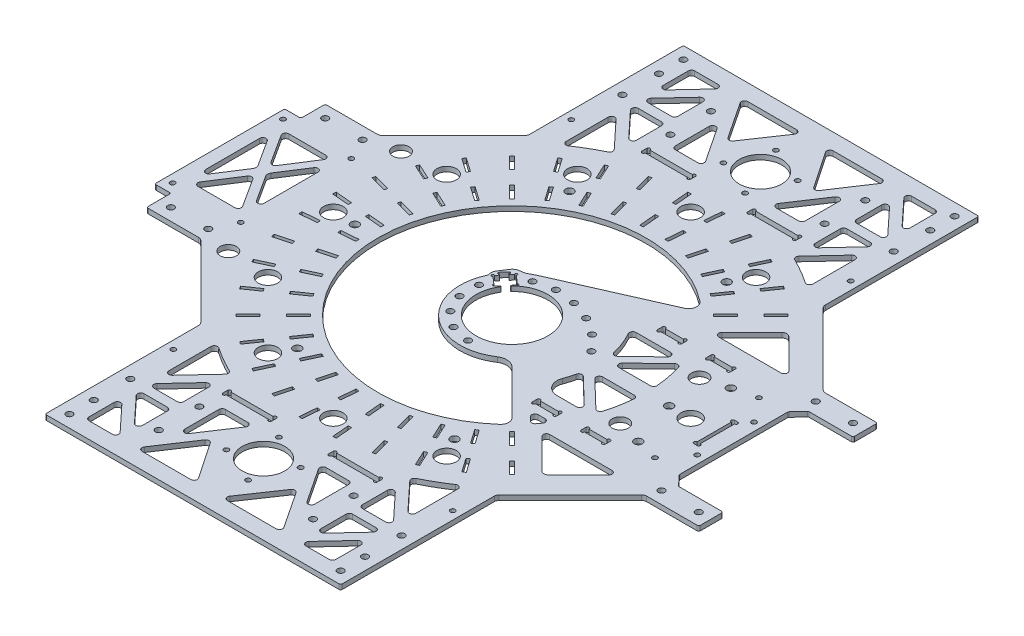
from build123d import *

# Parameters (mm, degrees)
EXTRUDE_2_OUTLINE_R   = 135
EXTRUDE_2_OUTLINE_R_2 = 2
EXTRUDE_2_OUTLINE_R_3 = 22.1
EXTRUDE_2_DEPTH       = 3
SKETCH_7_R            = 2.5
CUT_EXTRUDE_3_DEPTH   = 191.942399692
EXTRUDE_START         = -3
SKETCH_8_R            = 2
SKETCH_8_R_2          = 1.5
EXTRUDE_3_DEPTH       = 3
SKETCH_9_R            = 1.5
SKETCH_9_R_2          = 6
SKETCH_9_R_3          = 2.5
SKETCH_9_R_4          = 5
SKETCH_9_R_5          = 13.1
SKETCH_9_W            = 2
SKETCH_9_H            = 25
CUT_EXTRUDE_4_DEPTH   = 267.498123821
SKETCH_11_W           = 15
SKETCH_11_H           = 3
CUT_EXTRUDE_6_DEPTH   = 267.498123821
EXTRUDE_4_DEPTH       = 3
SKETCH_13_R           = 2
SKETCH_13_R_2         = 1.5
SKETCH_13_W           = 30
SKETCH_13_H           = 3
CUT_EXTRUDE_7_DEPTH   = 267.498123821
SKETCH_14_R           = 1
CUT_EXTRUDE_8_DEPTH   = 267.498123821
SKETCH_25_R           = 5
SKETCH_25_W           = 36
SKETCH_25_H           = 56
CUT_EXTRUDE_14_DEPTH  = 267.498123821
EXTRUDE_1_DEPTH       = 3
CUT_EXTRUDE_15_DEPTH  = 10
SKETCH_30_R           = 0.75
CUT_EXTRUDE_16_DEPTH  = 10
FILLET_1_R            = 3
FILLET_6_R            = 1
FILLET_8_R            = 2


with BuildPart() as part:
    # 凸台-拉伸2: read off the stored shape, not the designer's step
    # 凸台-拉伸2 outline → 凸台-拉伸2 (new body)
    with BuildSketch(Plane(origin=(0, 0, 0), x_dir=(1, 0, 0), z_dir=(0, 1, 0))):
        Circle(EXTRUDE_2_OUTLINE_R)
        with Locations((-11.714860956, -24.326159433)):
            Circle(EXTRUDE_2_OUTLINE_R_2, mode=Mode.SUBTRACT)
        with Locations((-21.109450027, -16.83422465)):
            Circle(EXTRUDE_2_OUTLINE_R_2, mode=Mode.SUBTRACT)
        with Locations((-26.323053629, -6.008065217)):
            Circle(EXTRUDE_2_OUTLINE_R_2, mode=Mode.SUBTRACT)
        with Locations((0, -27)):
            Circle(EXTRUDE_2_OUTLINE_R_2, mode=Mode.SUBTRACT)
        with Locations((-26.323053629, 6.008065217)):
            Circle(EXTRUDE_2_OUTLINE_R_2, mode=Mode.SUBTRACT)
        with Locations((-11.714860956, 24.326159433)):
            Circle(EXTRUDE_2_OUTLINE_R_2, mode=Mode.SUBTRACT)
        Circle(EXTRUDE_2_OUTLINE_R_3, mode=Mode.SUBTRACT)
        with Locations((0, 27)):
            Circle(EXTRUDE_2_OUTLINE_R_2, mode=Mode.SUBTRACT)
        with Locations((12.540402558, 25.523692784)):
            Circle(EXTRUDE_2_OUTLINE_R_2, mode=Mode.SUBTRACT)
        with Locations((24.405378925, 21.203563722)):
            Circle(EXTRUDE_2_OUTLINE_R_2, mode=Mode.SUBTRACT)
        with Locations((43.69592095, 5.163960916)):
            Circle(EXTRUDE_2_OUTLINE_R_2, mode=Mode.SUBTRACT)
        with Locations((34.97553353, 14.296103193)):
            Circle(EXTRUDE_2_OUTLINE_R_2, mode=Mode.SUBTRACT)
    extrude(amount=EXTRUDE_2_DEPTH)

    # 草图7 → 切除-拉伸3 (cut, through all)
    with BuildSketch(Plane(origin=(0, 3, 0), x_dir=(1, 0, 0), z_dir=(0, 1, 0))):
        with Locations(Location((96.75, 0, 0), (0, 0, 270))):
            Circle(SKETCH_7_R)
        with Locations(Location((48.375, -83.787957816, 0), (0, 0, 270))):
            Circle(SKETCH_7_R)
        with Locations(Location((-48.375, -83.787957816, 0), (0, 0, 270))):
            Circle(SKETCH_7_R)
        with Locations(Location((-96.75, 0, 0), (0, 0, 270))):
            Circle(SKETCH_7_R)
        with Locations(Location((-48.375, 83.787957816, 0), (0, 0, 270))):
            Circle(SKETCH_7_R)
        with Locations(Location((48.375, 83.787957816, 0), (0, 0, 270))):
            Circle(SKETCH_7_R)
        with BuildLine():
            Line((-23.944417996, 22.009220284), (-26.66858516, 18.812516785))
            Line((-26.66858516, 18.812516785), (-18.599424602, 11.936138592))
            ThreePointArc((-18.599424602, 11.936138592), (-17.380019908, 13.650820781), (-16.003077925, 15.241768169))
            Line((-16.003077925, 15.241768169), (-23.944417996, 22.009220284))
        make_face()
    extrude(amount=-CUT_EXTRUDE_3_DEPTH, mode=Mode.SUBTRACT)

    # 草图8 → 凸台-拉伸3 (add)
    # profile 1 of 4: a face of its own
    with BuildSketch(Plane(origin=(0, 3, 0), x_dir=(1, 0, 0), z_dir=(0, 1, 0)).offset(EXTRUDE_START)):
        with BuildLine():
            Line((123.288280059, 55), (170, 55))
            Line((170, 55), (170, 40))
            Line((170, 40), (142.5, 40))
            Line((142.5, 40), (136.5, 33.5))
            Line((136.5, 33.5), (136.5, -33.5))
            Line((136.5, -33.5), (142.5, -40))
            Line((142.5, -40), (170, -40))
            Line((170, -40), (170, -55))
            Line((170, -55), (123.288280059, -55))
            ThreePointArc((123.288280059, -55), (135, 0), (123.288280059, 55))
        make_face()
        with Locations(Location((162.5, 47.5, 0), (0, 0, 270))):
            Circle(SKETCH_8_R, mode=Mode.SUBTRACT)
        with Locations(Location((139.5, 47.5, 0), (0, 0, 270))):
            Circle(SKETCH_8_R, mode=Mode.SUBTRACT)
        with Locations(Location((139.5, -47.5, 0), (0, 0, 270))):
            Circle(SKETCH_8_R, mode=Mode.SUBTRACT)
        with Locations(Location((162.5, -47.5, 0), (0, 0, 270))):
            Circle(SKETCH_8_R, mode=Mode.SUBTRACT)
    # profile 2 of 4: a face of its own
    with BuildSketch(Plane(origin=(0, 3, 0), x_dir=(1, 0, 0), z_dir=(0, 1, 0)).offset(EXTRUDE_START)):
        with BuildLine():
            Line((-91, 99.719606899), (-91, 196.5))
            Line((-91, 196.5), (91, 196.5))
            Line((91, 196.5), (91, 99.719606899))
            ThreePointArc((91, 99.719606899), (0, 135), (-91, 99.719606899))
        make_face()
    # profile 3 of 4: a face of its own
    with BuildSketch(Plane(origin=(0, 3, 0), x_dir=(1, 0, 0), z_dir=(0, 1, 0)).offset(EXTRUDE_START)):
        with BuildLine():
            Line((91, -196.5), (91, -99.719606899))
            ThreePointArc((91, -99.719606899), (0, -135), (-91, -99.719606899))
            Line((-91, -99.719606899), (-91, -196.5))
            Line((-91, -196.5), (91, -196.5))
        make_face()
    # profile 4 of 4: a face of its own
    with BuildSketch(Plane(origin=(0, 3, 0), x_dir=(1, 0, 0), z_dir=(0, 1, 0)).offset(EXTRUDE_START)):
        with BuildLine():
            Line((-123.288280059, -55), (-170, -55))
            Line((-170, -55), (-170, -40))
            Line((-170, -40), (-180, -40))
            Line((-180, -40), (-180, 40))
            Line((-180, 40), (-170, 40))
            Line((-170, 40), (-170, 55))
            Line((-170, 55), (-123.288280059, 55))
            ThreePointArc((-123.288280059, 55), (-135, 0), (-123.288280059, -55))
        make_face()
        with Locations(Location((-162.5, -47.5, 0), (0, 0, 270))):
            Circle(SKETCH_8_R, mode=Mode.SUBTRACT)
        with Locations(Location((-139.5, -47.5, 0), (0, 0, 270))):
            Circle(SKETCH_8_R, mode=Mode.SUBTRACT)
        with Locations(Location((-139.5, 47.5, 0), (0, 0, 270))):
            Circle(SKETCH_8_R, mode=Mode.SUBTRACT)
        with Locations(Location((-162.5, 47.5, 0), (0, 0, 270))):
            Circle(SKETCH_8_R, mode=Mode.SUBTRACT)
        with Locations(Location((-175, 34, 0), (0, 0, 270))):
            Circle(SKETCH_8_R_2, mode=Mode.SUBTRACT)
        with Locations(Location((-175, -34, 0), (0, 0, 270))):
            Circle(SKETCH_8_R_2, mode=Mode.SUBTRACT)
        with Locations(Location((-133, -34, 0), (0, 0, 270))):
            Circle(SKETCH_8_R_2, mode=Mode.SUBTRACT)
        with Locations(Location((-133, 34, 0), (0, 0, 270))):
            Circle(SKETCH_8_R_2, mode=Mode.SUBTRACT)
    extrude(amount=EXTRUDE_3_DEPTH)

    # 草图9 → 切除-拉伸4 (cut, through all)
    with BuildSketch(Plane(origin=(0, 3, 0), x_dir=(1, 0, 0), z_dir=(0, 1, 0))):
        with Locations(Location((-6.696960066, 169.167891819, 0), (0, 0, 270))):
            Circle(SKETCH_9_R)
        with Locations(Location((0, 110, 0), (0, 0, 270))):
            Circle(SKETCH_9_R_2)
        with Locations(Location((106.251840892, 28.470094961, 0), (0, 0, 270))):
            Circle(SKETCH_9_R_3)
        with Locations(Location((55, 95.262794416, 0), (0, 0, 270))):
            Circle(SKETCH_9_R_2)
        with Locations(Location((91.038509128, 24.393695001, 0), (0, 0, 270))):
            Circle(SKETCH_9_R_4)
        with Locations(Location((91.038509128, -24.393695001, 0), (0, 0, 270))):
            Circle(SKETCH_9_R_4)
        with Locations(Location((106.251840892, -28.470094961, 0), (0, 0, 270))):
            Circle(SKETCH_9_R_3)
        with Locations(Location((110, 0, 0), (0, 0, 270))):
            Circle(SKETCH_9_R_2)
        with Locations(Location((55, -95.262794416, 0), (0, 0, 270))):
            Circle(SKETCH_9_R_2)
        with Locations(Location((0, -110, 0), (0, 0, 270))):
            Circle(SKETCH_9_R_2)
        with Locations(Location((-55, -95.262794416, 0), (0, 0, 270))):
            Circle(SKETCH_9_R_2)
        with Locations(Location((-95.262794416, -55, 0), (0, 0, 270))):
            Circle(SKETCH_9_R_2)
        with Locations(Location((-110, 0, 0), (0, 0, 270))):
            Circle(SKETCH_9_R_2)
        with Locations(Location((-95.262794416, 55, 0), (0, 0, 270))):
            Circle(SKETCH_9_R_2)
        with Locations(Location((-55, 95.262794416, 0), (0, 0, 270))):
            Circle(SKETCH_9_R_2)
        with Locations(Location((120, 32, 0), (0, 0, 270))):
            Circle(SKETCH_9_R)
        with Locations(Location((120, -32, 0), (0, 0, 270))):
            Circle(SKETCH_9_R)
        with Locations(Location((0, 153, 0), (0, 0, 270))):
            Circle(SKETCH_9_R_5)
        with Locations(Location((16.167891819, 159.696960066, 0), (0, 0, 270))):
            Circle(SKETCH_9_R)
        with Locations(Location((6.696960066, 136.832108181, 0), (0, 0, 270))):
            Circle(SKETCH_9_R)
        with Locations(Location((-16.167891819, 146.303039934, 0), (0, 0, 270))):
            Circle(SKETCH_9_R)
        with Locations(Location((-6.696960066, -136.832108181, 0), (0, 0, 270))):
            Circle(SKETCH_9_R)
        with Locations(Location((0, -153, 0), (0, 0, 270))):
            Circle(SKETCH_9_R_5)
        with Locations(Location((16.167891819, -146.303039934, 0), (0, 0, 270))):
            Circle(SKETCH_9_R)
        with Locations(Location((6.696960066, -169.167891819, 0), (0, 0, 270))):
            Circle(SKETCH_9_R)
        with Locations(Location((-16.167891819, -159.696960066, 0), (0, 0, 270))):
            Circle(SKETCH_9_R)
        with Locations(Location((131.5, 17.5, 0), (0, 0, 270))):
            Circle(SKETCH_9_R)
        with Locations(Location((131.5, -17.5, 0), (0, 0, 90))):
            Circle(SKETCH_9_R)
        with BuildLine():
            Line((-12.931672736, 29.270665183), (49.357543828, 56.789813059))
            ThreePointArc((49.357543828, 56.789813059), (52.300695439, 60.76216451), (50.390968025, 65.32228059))
            ThreePointArc((50.390968025, 65.32228059), (-82.458070407, -2.629947673), (54.45114247, -61.978408205))
            ThreePointArc((54.45114247, -61.978408205), (56.148468382, -58.383515435), (54.686607136, -54.686607136))
            Line((54.686607136, -54.686607136), (27.712812921, -27.712812921))
            ThreePointArc((27.712812921, -27.712812921), (22.860030368, -25.410177947), (17.644766937, -26.695733736))
            ThreePointArc((17.644766937, -26.695733736), (-21.048434027, -24.103182881), (-28.829108868, 13.888213775))
            ThreePointArc((-28.829108868, 13.888213775), (-28.782435247, 14.075330073), (-28.814021115, 14.265575358))
            ThreePointArc((-28.814021115, 14.265575358), (-29.122939909, 16.594282895), (-28.334302935, 18.807055213))
            Line((-28.334302935, 18.807055213), (-25.048700438, 23.827495058))
            ThreePointArc((-25.048700438, 23.827495058), (-23.336585416, 25.435901649), (-21.078911577, 26.08491509))
            ThreePointArc((-21.078911577, 26.08491509), (-18.645378551, 26.493867679), (-16.386082739, 27.486292811))
            ThreePointArc((-16.386082739, 27.486292811), (-14.686003293, 28.430992021), (-12.931672736, 29.270665183))
        make_face()
        with Locations((125.5, 0)):
            Rectangle(SKETCH_9_W, SKETCH_9_H)
    extrude(amount=-CUT_EXTRUDE_4_DEPTH, mode=Mode.SUBTRACT)

    # 草图11 → 切除-拉伸6 (cut, through all)
    with BuildSketch(Plane(origin=(0, 3, 0), x_dir=(1, 0, 0), z_dir=(0, 1, 0))):
        Polygon((62.791082169, -61.376868607), (70.144992694, -68.730779131), (68.730779131, -70.144992694), (61.376868607, -62.791082169), align=None)
        Polygon((78.347431355, -76.933217793), (85.70134188, -84.287128317), (84.287128317, -85.70134188), (76.933217793, -78.347431355), align=None)
        Polygon((51.179163156, -71.347973052), (57.144358094, -79.867154313), (55.506054005, -81.014307186), (49.540859067, -72.495125925), align=None)
        Polygon((63.797844756, -89.369318027), (69.763039694, -97.888499287), (68.124735605, -99.03565216), (62.159540667, -90.516470899), align=None)
        Polygon((38.012191168, -79.15120544), (42.40742109, -88.576806425), (40.594805516, -89.422042949), (36.199575594, -79.996441964), align=None)
        Polygon((47.309792926, -99.089976755), (51.705022848, -108.51557774), (49.892407274, -109.360814264), (45.497177352, -99.935213278), align=None)
        Polygon((23.690237986, -84.549468503), (26.381956055, -94.595097096), (24.450104403, -95.112735187), (21.758386334, -85.067106593), align=None)
        Polygon((29.384256979, -105.799836681), (32.075975048, -115.845465275), (30.144123395, -116.363103365), (27.452405326, -106.317474772), align=None)
        Polygon((8.648468911, -87.37873875), (9.554888636, -97.73916361), (7.56249924, -97.913475095), (6.656079515, -87.553050235), align=None)
        Polygon((10.565895252, -109.295022108), (11.472314976, -119.655446968), (9.47992558, -119.829758453), (8.573505856, -109.469333593), align=None)
        Polygon((-6.656079515, -87.553050235), (-7.56249924, -97.913475095), (-9.554888636, -97.73916361), (-8.648468911, -87.37873875), align=None)
        Polygon((-8.573505856, -109.469333593), (-9.47992558, -119.829758453), (-11.472314976, -119.655446968), (-10.565895252, -109.295022108), align=None)
        Polygon((-21.758386334, -85.067106593), (-24.450104403, -95.112735187), (-26.381956055, -94.595097096), (-23.690237986, -84.549468503), align=None)
        Polygon((-27.452405326, -106.317474772), (-30.144123395, -116.363103365), (-32.075975048, -115.845465275), (-29.384256979, -105.799836681), align=None)
        Polygon((-36.199575594, -79.996441964), (-40.594805516, -89.422042949), (-42.40742109, -88.576806425), (-38.012191168, -79.15120544), align=None)
        Polygon((-45.497177352, -99.935213278), (-49.892407274, -109.360814264), (-51.705022848, -108.51557774), (-47.309792926, -99.089976755), align=None)
        Polygon((-49.540859067, -72.495125925), (-55.506054005, -81.014307186), (-57.144358094, -79.867154313), (-51.179163156, -71.347973052), align=None)
        Polygon((-62.159540667, -90.516470899), (-68.124735605, -99.03565216), (-69.763039694, -97.888499287), (-63.797844756, -89.369318027), align=None)
        Polygon((-61.376868607, -62.791082169), (-68.730779131, -70.144992694), (-70.144992694, -68.730779131), (-62.791082169, -61.376868607), align=None)
        Polygon((-76.933217793, -78.347431355), (-84.287128317, -85.70134188), (-85.70134188, -84.287128317), (-78.347431355, -76.933217793), align=None)
        Polygon((-71.347973052, -51.179163156), (-79.867154313, -57.144358094), (-81.014307186, -55.506054005), (-72.495125925, -49.540859067), align=None)
        Polygon((-89.369318027, -63.797844756), (-97.888499287, -69.763039694), (-99.03565216, -68.124735605), (-90.516470899, -62.159540667), align=None)
        Polygon((-79.15120544, -38.012191168), (-88.576806425, -42.40742109), (-89.422042949, -40.594805516), (-79.996441964, -36.199575594), align=None)
        Polygon((-99.089976755, -47.309792926), (-108.51557774, -51.705022848), (-109.360814264, -49.892407274), (-99.935213278, -45.497177352), align=None)
        Polygon((-84.549468503, -23.690237986), (-94.595097096, -26.381956055), (-95.112735187, -24.450104403), (-85.067106593, -21.758386334), align=None)
        Polygon((-105.799836681, -29.384256979), (-115.845465275, -32.075975048), (-116.363103365, -30.144123395), (-106.317474772, -27.452405326), align=None)
        Polygon((-87.37873875, -8.648468911), (-97.73916361, -9.554888636), (-97.913475095, -7.56249924), (-87.553050235, -6.656079515), align=None)
        Polygon((-109.295022108, -10.565895252), (-119.655446968, -11.472314976), (-119.829758453, -9.47992558), (-109.469333593, -8.573505856), align=None)
        Polygon((-87.553050235, 6.656079515), (-97.913475095, 7.56249924), (-97.73916361, 9.554888636), (-87.37873875, 8.648468911), align=None)
        Polygon((-109.469333593, 8.573505856), (-119.829758453, 9.47992558), (-119.655446968, 11.472314976), (-109.295022108, 10.565895252), align=None)
        Polygon((-85.067106593, 21.758386334), (-95.112735187, 24.450104403), (-94.595097096, 26.381956055), (-84.549468503, 23.690237986), align=None)
        Polygon((-106.317474772, 27.452405326), (-116.363103365, 30.144123395), (-115.845465275, 32.075975048), (-105.799836681, 29.384256979), align=None)
        Polygon((-79.996441964, 36.199575594), (-89.422042949, 40.594805516), (-88.576806425, 42.40742109), (-79.15120544, 38.012191168), align=None)
        Polygon((-99.935213278, 45.497177352), (-109.360814264, 49.892407274), (-108.51557774, 51.705022848), (-99.089976755, 47.309792926), align=None)
        Polygon((-72.495125925, 49.540859067), (-81.014307186, 55.506054005), (-79.867154313, 57.144358094), (-71.347973052, 51.179163156), align=None)
        Polygon((-90.516470899, 62.159540667), (-99.03565216, 68.124735605), (-97.888499287, 69.763039694), (-89.369318027, 63.797844756), align=None)
        Polygon((-62.791082169, 61.376868607), (-70.144992694, 68.730779131), (-68.730779131, 70.144992694), (-61.376868607, 62.791082169), align=None)
        Polygon((-78.347431355, 76.933217793), (-85.70134188, 84.287128317), (-84.287128317, 85.70134188), (-76.933217793, 78.347431355), align=None)
        Polygon((-51.179163156, 71.347973052), (-57.144358094, 79.867154313), (-55.506054005, 81.014307186), (-49.540859067, 72.495125925), align=None)
        Polygon((-63.797844756, 89.369318027), (-69.763039694, 97.888499287), (-68.124735605, 99.03565216), (-62.159540667, 90.516470899), align=None)
        Polygon((-38.012191168, 79.15120544), (-42.40742109, 88.576806425), (-40.594805516, 89.422042949), (-36.199575594, 79.996441964), align=None)
        Polygon((-47.309792926, 99.089976755), (-51.705022848, 108.51557774), (-49.892407274, 109.360814264), (-45.497177352, 99.935213278), align=None)
        Polygon((-23.690237986, 84.549468503), (-26.381956055, 94.595097096), (-24.450104403, 95.112735187), (-21.758386334, 85.067106593), align=None)
        Polygon((-29.384256979, 105.799836681), (-32.075975048, 115.845465275), (-30.144123395, 116.363103365), (-27.452405326, 106.317474772), align=None)
        Polygon((-8.648468911, 87.37873875), (-9.554888636, 97.73916361), (-7.56249924, 97.913475095), (-6.656079515, 87.553050235), align=None)
        Polygon((-10.565895252, 109.295022108), (-11.472314976, 119.655446968), (-9.47992558, 119.829758453), (-8.573505856, 109.469333593), align=None)
        Polygon((6.656079515, 87.553050235), (7.56249924, 97.913475095), (9.554888636, 97.73916361), (8.648468911, 87.37873875), align=None)
        Polygon((8.573505856, 109.469333593), (9.47992558, 119.829758453), (11.472314976, 119.655446968), (10.565895252, 109.295022108), align=None)
        Polygon((21.758386334, 85.067106593), (24.450104403, 95.112735187), (26.381956055, 94.595097096), (23.690237986, 84.549468503), align=None)
        Polygon((27.452405326, 106.317474772), (30.144123395, 116.363103365), (32.075975048, 115.845465275), (29.384256979, 105.799836681), align=None)
        Polygon((36.199575594, 79.996441964), (40.594805516, 89.422042949), (42.40742109, 88.576806425), (38.012191168, 79.15120544), align=None)
        Polygon((45.497177352, 99.935213278), (49.892407274, 109.360814264), (51.705022848, 108.51557774), (47.309792926, 99.089976755), align=None)
        Polygon((49.540859067, 72.495125925), (55.506054005, 81.014307186), (57.144358094, 79.867154313), (51.179163156, 71.347973052), align=None)
        Polygon((62.159540667, 90.516470899), (68.124735605, 99.03565216), (69.763039694, 97.888499287), (63.797844756, 89.369318027), align=None)
        Polygon((61.376868607, 62.791082169), (68.730779131, 70.144992694), (70.144992694, 68.730779131), (62.791082169, 61.376868607), align=None)
        Polygon((76.933217793, 78.347431355), (84.287128317, 85.70134188), (85.70134188, 84.287128317), (78.347431355, 76.933217793), align=None)
        with Locations((60, 38.5)):
            Rectangle(SKETCH_11_W, SKETCH_11_H)
        with Locations((60, -38.5)):
            Rectangle(SKETCH_11_W, SKETCH_11_H)
        with Locations((90, 38.5)):
            Rectangle(SKETCH_11_W, SKETCH_11_H)
        with Locations((90, -38.5)):
            Rectangle(SKETCH_11_W, SKETCH_11_H)
    extrude(amount=-CUT_EXTRUDE_6_DEPTH, mode=Mode.SUBTRACT)

    # 草图12 → 凸台-拉伸4 (add)
    with BuildSketch(Plane(origin=(0, 3, 0), x_dir=(1, 0, 0), z_dir=(0, 1, 0)).offset(EXTRUDE_START)):
        with BuildLine():
            Line((91, 100.625937702), (136.625937702, 55))
            Line((136.625937702, 55), (123.288280059, 55))
            ThreePointArc((123.288280059, 55), (109.452398571, 79.02640348), (91, 99.719606899))
            Line((91, 99.719606899), (91, 100.625937702))
        make_face()
        with BuildLine():
            Line((91, -100.625937702), (136.625937702, -55))
            Line((136.625937702, -55), (123.288280059, -55))
            ThreePointArc((123.288280059, -55), (109.452398571, -79.02640348), (91, -99.719606899))
            Line((91, -99.719606899), (91, -100.625937702))
        make_face()
        with BuildLine():
            Line((-91, -100.625937702), (-91, -99.719606899))
            ThreePointArc((-91, -99.719606899), (-109.452398571, -79.02640348), (-123.288280059, -55))
            Line((-123.288280059, -55), (-136.625937702, -55))
            Line((-136.625937702, -55), (-91, -100.625937702))
        make_face()
        with BuildLine():
            Line((-136.625937702, 55), (-123.288280059, 55))
            ThreePointArc((-123.288280059, 55), (-109.452398571, 79.02640348), (-91, 99.719606899))
            Line((-91, 99.719606899), (-91, 100.625937702))
            Line((-91, 100.625937702), (-136.625937702, 55))
        make_face()
    extrude(amount=EXTRUDE_4_DEPTH)

    # 草图13 → 切除-拉伸7 (cut, through all)
    with BuildSketch(Plane(origin=(0, 3, 0), x_dir=(1, 0, 0), z_dir=(0, 1, 0))):
        with Locations(Location((83.5, -151.5, 0), (0, 0, 90))):
            Circle(SKETCH_13_R)
        with Locations(Location((47.5, 145, 0), (0, 0, 270))):
            Circle(SKETCH_13_R)
        with Locations(Location((-47.5, 145, 0), (0, 0, 270))):
            Circle(SKETCH_13_R)
        with Locations(Location((-47.5, 170, 0), (0, 0, 270))):
            Circle(SKETCH_13_R)
        with Locations(Location((47.5, 170, 0), (0, 0, 270))):
            Circle(SKETCH_13_R)
        with Locations(Location((-47.5, -170, 0), (0, 0, 90))):
            Circle(SKETCH_13_R)
        with Locations(Location((-47.5, -145, 0), (0, 0, 90))):
            Circle(SKETCH_13_R)
        with Locations(Location((47.5, -170, 0), (0, 0, 90))):
            Circle(SKETCH_13_R)
        with Locations(Location((47.5, -145, 0), (0, 0, 90))):
            Circle(SKETCH_13_R)
        with Locations(Location((83.5, -174, 0), (0, 0, 90))):
            Circle(SKETCH_13_R)
        with Locations(Location((83.5, 189, 0), (0, 0, 270))):
            Circle(SKETCH_13_R)
        with Locations(Location((83.5, 174, 0), (0, 0, 270))):
            Circle(SKETCH_13_R)
        with Locations(Location((83.5, 151.5, 0), (0, 0, 270))):
            Circle(SKETCH_13_R)
        with Locations(Location((83.5, -189, 0), (0, 0, 90))):
            Circle(SKETCH_13_R)
        with Locations(Location((-83.5, 151.5, 0), (0, 0, 90))):
            Circle(SKETCH_13_R)
        with Locations(Location((-83.5, 174, 0), (0, 0, 90))):
            Circle(SKETCH_13_R)
        with Locations(Location((-83.5, 189, 0), (0, 0, 90))):
            Circle(SKETCH_13_R)
        with Locations(Location((-83.5, -174, 0), (0, 0, 270))):
            Circle(SKETCH_13_R)
        with Locations(Location((-83.5, -151.5, 0), (0, 0, 270))):
            Circle(SKETCH_13_R)
        with Locations(Location((-83.5, -189, 0), (0, 0, 270))):
            Circle(SKETCH_13_R)
        with Locations(Location((85.999999851, 122.500000104, 0), (0, 0, 270))):
            Circle(SKETCH_13_R_2)
        with Locations(Location((-85.999999851, 122.500000104, 0), (0, 0, 90))):
            Circle(SKETCH_13_R_2)
        with Locations(Location((-85.999999851, -122.500000104, 0), (0, 0, 270))):
            Circle(SKETCH_13_R_2)
        with Locations(Location((85.999999851, -122.500000104, 0), (0, 0, 90))):
            Circle(SKETCH_13_R_2)
        with Locations((-32.5, 129)):
            Rectangle(SKETCH_13_W, SKETCH_13_H)
        with Locations((32.5, 129)):
            Rectangle(SKETCH_13_W, SKETCH_13_H)
        with Locations((32.5, -129)):
            Rectangle(SKETCH_13_W, SKETCH_13_H)
        with Locations((-32.5, -129)):
            Rectangle(SKETCH_13_W, SKETCH_13_H)
    extrude(amount=-CUT_EXTRUDE_7_DEPTH, mode=Mode.SUBTRACT)

    # 草图14 → 切除-拉伸8 (cut, through all)
    with BuildSketch(Plane(origin=(0, 3, 0), x_dir=(1, 0, 0), z_dir=(0, 1, 0))):
        with Locations((-46.5, 130.5)):
            Circle(SKETCH_14_R)
        with Locations((-46.5, 127.5)):
            Circle(SKETCH_14_R)
        with Locations((-18.5, 127.5)):
            Circle(SKETCH_14_R)
        with Locations((18.5, 130.5)):
            Circle(SKETCH_14_R)
        with Locations((18.5, 127.5)):
            Circle(SKETCH_14_R)
        with Locations((46.5, 130.5)):
            Circle(SKETCH_14_R)
        with Locations((46.5, 127.5)):
            Circle(SKETCH_14_R)
        with Locations((46.5, -127.5)):
            Circle(SKETCH_14_R)
        with Locations((46.5, -130.5)):
            Circle(SKETCH_14_R)
        with Locations((18.5, -127.5)):
            Circle(SKETCH_14_R)
        with Locations((18.5, -130.5)):
            Circle(SKETCH_14_R)
        with Locations((-18.5, -127.5)):
            Circle(SKETCH_14_R)
        with Locations((-46.5, -127.5)):
            Circle(SKETCH_14_R)
        with Locations((-46.5, -130.5)):
            Circle(SKETCH_14_R)
        with Locations((-18.5, 130.5)):
            Circle(SKETCH_14_R)
        with Locations((-18.5, -130.5)):
            Circle(SKETCH_14_R)
        with Locations((53.5, 40)):
            Circle(SKETCH_14_R)
        with Locations((53.5, 37)):
            Circle(SKETCH_14_R)
        with Locations((66.5, 40)):
            Circle(SKETCH_14_R)
        with Locations((66.5, 37)):
            Circle(SKETCH_14_R)
        with Locations((83.5, 40)):
            Circle(SKETCH_14_R)
        with Locations((83.5, 37)):
            Circle(SKETCH_14_R)
        with Locations((96.5, 40)):
            Circle(SKETCH_14_R)
        with Locations((96.5, 37)):
            Circle(SKETCH_14_R)
        with Locations((96.5, -37)):
            Circle(SKETCH_14_R)
        with Locations((96.5, -40)):
            Circle(SKETCH_14_R)
        with Locations((83.5, -37)):
            Circle(SKETCH_14_R)
        with Locations((83.5, -40)):
            Circle(SKETCH_14_R)
        with Locations((66.5, -37)):
            Circle(SKETCH_14_R)
        with Locations((66.5, -40)):
            Circle(SKETCH_14_R)
        with Locations((53.5, -37)):
            Circle(SKETCH_14_R)
        with Locations((53.5, -40)):
            Circle(SKETCH_14_R)
        with BuildLine():
            Line((126.5, -12.5), (126.5, -10.5))
            ThreePointArc((126.5, -10.5), (127.5, -11.5), (126.5, -12.5))
        make_face()
        with BuildLine():
            Line((124.5, 12.5), (124.5, 10.5))
            ThreePointArc((124.5, 10.5), (123.5, 11.5), (124.5, 12.5))
        make_face()
        with BuildLine():
            Line((126.5, 10.5), (126.5, 12.5))
            ThreePointArc((126.5, 12.5), (127.5, 11.5), (126.5, 10.5))
        make_face()
        with BuildLine():
            Line((124.5, -10.5), (124.5, -12.5))
            ThreePointArc((124.5, -12.5), (123.5, -11.5), (124.5, -10.5))
        make_face()
    extrude(amount=-CUT_EXTRUDE_8_DEPTH, mode=Mode.SUBTRACT)

    # 草图25 → 切除-拉伸14 (cut, through all)
    with BuildSketch(Plane(origin=(0, 3, 0), x_dir=(1, 0, 0), z_dir=(0, 1, 0))):
        with Locations(Location((-121.5, 53.155374953, 0), (0, 0, 270))):
            Circle(SKETCH_25_R)
        with Locations(Location((-121.5, -53.155374953, 0), (0, 0, 90))):
            Circle(SKETCH_25_R)
        Polygon((70.384776311, -52), (94.398755288, -76.013978978), (118.412734266, -52), align=None)
        with BuildLine():
            Line((76, 140.342111734), (76, 105.470374987))
            ThreePointArc((76, 105.470374987), (65.789108374, 112.12400822), (55, 117.792189894))
            Line((55, 117.792189894), (76, 140.342111734))
        make_face()
        with Locations((-154, 0)):
            Rectangle(SKETCH_25_W, SKETCH_25_H)
        with BuildLine():
            Line((43.763569324, 29), (77.235030912, 29))
            ThreePointArc((77.235030912, 29), (80.688992456, 17.191174957), (82.34834546, 5))
            Line((82.34834546, 5), (52.261362401, 5))
            ThreePointArc((52.261362401, 5), (49.489361263, 17.522931313), (43.763569324, 29))
        make_face()
        Polygon((40, 168.096752718), (20.382120685, 138.5), (40, 138.5), align=None)
        with BuildLine():
            Line((52.261362401, -5), (82.34834546, -5))
            ThreePointArc((82.34834546, -5), (80.688992456, -17.191174957), (77.235030912, -29))
            Line((77.235030912, -29), (56.738434945, -29))
            ThreePointArc((56.738434945, -29), (50.172809459, -25.570838215), (49.235831977, -18.223140496))
            ThreePointArc((49.235831977, -18.223140496), (51.177465527, -11.709697785), (52.261362401, -5))
        make_face()
        with BuildLine():
            Line((56.313708499, -45), (63.718244174, -52.404535675))
            ThreePointArc((63.718244174, -52.404535675), (66.535497223, -48.777839326), (69.14658343, -45))
            Line((69.14658343, -45), (56.313708499, -45))
        make_face()
        Polygon((118.412734266, 52), (70.384776311, 52), (94.398755288, 76.013978978), align=None)
        Polygon((7.5, 186.5), (45, 186.5), (26.455863104, 158.523161869), align=None)
        Polygon((55, 177.696016787), (55, 155.146094947), (76, 155.146094947), align=None)
        Polygon((55, 149.146094947), (55, 126.596173107), (76, 149.146094947), align=None)
        Polygon((76, 163.95007816), (76, 186.5), (55, 186.5), align=None)
        with BuildLine():
            Line((-55, 117.792189894), (-76, 140.342111734))
            Line((-76, 140.342111734), (-76, 105.470374987))
            ThreePointArc((-76, 105.470374987), (-65.789108374, 112.12400822), (-55, 117.792189894))
        make_face()
        Polygon((-55, 186.5), (-76, 163.95007816), (-76, 186.5), align=None)
        Polygon((-76, 149.146094947), (-55, 149.146094947), (-55, 126.596173107), align=None)
        Polygon((-76, 155.146094947), (-55, 177.696016787), (-55, 155.146094947), align=None)
        Polygon((-26.455863104, 158.523161869), (-7.5, 186.5), (-45, 186.5), align=None)
        Polygon((-40, 138.5), (-40, 168.096752718), (-20.382120685, 138.5), align=None)
        with BuildLine():
            Line((-76, -140.342111734), (-76, -105.470374987))
            ThreePointArc((-76, -105.470374987), (-65.789108374, -112.12400822), (-55, -117.792189894))
            Line((-55, -117.792189894), (-76, -140.342111734))
        make_face()
        Polygon((-40, -168.096752718), (-20.382120685, -138.5), (-40, -138.5), align=None)
        Polygon((-7.5, -186.5), (-45, -186.5), (-26.455863104, -158.523161869), align=None)
        Polygon((-55, -177.696016787), (-55, -155.146094947), (-76, -155.146094947), align=None)
        Polygon((-55, -149.146094947), (-55, -126.596173107), (-76, -149.146094947), align=None)
        Polygon((-76, -163.95007816), (-76, -186.5), (-55, -186.5), align=None)
        with BuildLine():
            Line((55, -117.792189894), (76, -140.342111734))
            Line((76, -140.342111734), (76, -105.470374987))
            ThreePointArc((76, -105.470374987), (65.789108374, -112.12400822), (55, -117.792189894))
        make_face()
        Polygon((55, -186.5), (76, -163.95007816), (76, -186.5), align=None)
        Polygon((76, -149.146094947), (55, -149.146094947), (55, -126.596173107), align=None)
        Polygon((76, -155.146094947), (55, -177.696016787), (55, -155.146094947), align=None)
        Polygon((26.455863104, -158.523161869), (7.5, -186.5), (45, -186.5), align=None)
        Polygon((40, -138.5), (40, -168.096752718), (20.382120685, -138.5), align=None)
    extrude(amount=-CUT_EXTRUDE_14_DEPTH, mode=Mode.SUBTRACT)

    # 草图26 → Extrude 1 (add)
    with BuildSketch(Plane(origin=(0, 3, 0), x_dir=(1, 0, 0), z_dir=(0, 1, 0))):
        Polygon((-133.897053812, -26.648106022), (-169.897053812, 29.351893978), (-174.102946188, 26.648106022), (-138.102946188, -29.351893978), align=None)
        Polygon((-169.897053812, -29.351893978), (-133.897053812, 26.648106022), (-138.102946188, 29.351893978), (-174.102946188, -26.648106022), align=None)
        Polygon((75.502752092, 30.802556543), (50.529083581, 6.802556543), (53.993641221, 3.197443457), (78.967309732, 27.197443457), align=None)
        Polygon((50.529083581, -6.802556543), (75.502752092, -30.802556543), (78.967309732, -27.197443457), (53.993641221, -3.197443457), align=None)
    extrude(amount=-EXTRUDE_1_DEPTH)

    # 草图28 → 切除-拉伸15 (cut)
    with BuildSketch(Plane(origin=(0, 3, 0), x_dir=(1, 0, 0), z_dir=(0, 1, 0))):
        Polygon((-22.422178234, 20.711997825), (-24.096641972, 22.13894253), (-26.820809136, 18.942239031), (-25.146345398, 17.515294326), (-27.092179087, 15.231934683), (-21.00322004, 10.043044847), (-19.057386352, 12.32640449), (-18.599424602, 11.936138592), (-16.003077925, 15.241768169), (-16.333219188, 15.523107989), (-14.387385499, 17.806467631), (-20.476344546, 22.995357468), align=None)
    extrude(amount=-CUT_EXTRUDE_15_DEPTH, mode=Mode.SUBTRACT)

    # 草图30 → 切除-拉伸16 (cut)
    with BuildSketch(Plane(origin=(0, 3, 0), x_dir=(1, 0, 0), z_dir=(0, 1, 0))):
        with Locations((-20.476344546, 22.995357468)):
            Circle(SKETCH_30_R)
        with Locations((-14.387385499, 17.806467631)):
            Circle(SKETCH_30_R)
        with Locations((-27.092179087, 15.231934683)):
            Circle(SKETCH_30_R)
        with Locations((-26.249969225, 18.455780609)):
            Circle(SKETCH_30_R)
        with Locations((-23.525802061, 21.652484108)):
            Circle(SKETCH_30_R)
        with Locations((-21.574059951, 10.529503269)):
            Circle(SKETCH_30_R)
    extrude(amount=-CUT_EXTRUDE_16_DEPTH, mode=Mode.SUBTRACT)

    # 圆角1
    fillet_1_edges = [part.edges().sort_by_distance(p)[0] for p in [
        (91, 1.5, -100.625937702),
        (136.625937702, 1.5, -55),
        (91, 1.5, 100.625937702),
        (136.625937702, 1.5, 55),
        (-136.625937702, 1.5, -55),
        (-91, 1.5, -100.625937702),
        (-91, 1.5, 100.625937702),
        (-136.625937702, 1.5, 55),
        (94.398755288, 1.5, 76.013978978),
        (94.398755288, 1.5, -76.013978978),
        (-156.972020889, 1.5, 0),
        (-151.027979111, 1.5, 0),
    ]]
    fillet(fillet_1_edges, radius=FILLET_1_R)

    # 圆角6
    fillet_6_edges = [part.edges().sort_by_distance(p)[0] for p in [
        (170, 1.5, 55),
        (170, 1.5, 40),
        (142.5, 1.5, 40),
        (136.5, 1.5, 33.5),
        (136.5, 1.5, -33.5),
        (142.5, 1.5, -40),
        (170, 1.5, -40),
        (170, 1.5, -55),
        (-91, 1.5, -196.5),
        (91, 1.5, -196.5),
        (91, 1.5, 196.5),
        (-91, 1.5, 196.5),
        (-170, 1.5, -55),
        (-170, 1.5, -40),
        (-180, 1.5, -40),
        (-180, 1.5, 40),
        (-170, 1.5, 40),
        (-170, 1.5, 55),
    ]]
    fillet(fillet_6_edges, radius=FILLET_6_R)

    # 圆角8
    fillet_8_edges = [part.edges().sort_by_distance(p)[0] for p in [
        (-55, 1.5, -126.596173107),
        (-76, 1.5, -149.146094947),
        (-55, 1.5, -149.146094947),
        (-76, 1.5, -186.5),
        (-55, 1.5, -186.5),
        (-76, 1.5, -163.95007816),
        (-55, 1.5, -117.792189894),
        (-76, 1.5, -105.470374987),
        (-76, 1.5, -140.342111734),
        (-76, 1.5, 105.470374987),
        (-55, 1.5, 117.792189894),
        (-76, 1.5, 140.342111734),
        (-20.382120685, 1.5, -138.5),
        (-40, 1.5, -138.5),
        (-40, 1.5, -168.096752718),
        (-26.455863104, 1.5, -158.523161869),
        (-45, 1.5, -186.5),
        (-7.5, 1.5, -186.5),
        (-55, 1.5, -155.146094947),
        (-76, 1.5, -155.146094947),
        (-55, 1.5, -177.696016787),
        (70.384776311, 1.5, 52),
        (118.412734266, 1.5, 52),
        (55, 1.5, -117.792189894),
        (76, 1.5, -140.342111734),
        (76, 1.5, -105.470374987),
        (26.455863104, 1.5, -158.523161869),
        (7.5, 1.5, -186.5),
        (45, 1.5, -186.5),
        (40, 1.5, -168.096752718),
        (40, 1.5, -138.5),
        (20.382120685, 1.5, -138.5),
        (76, 1.5, -163.95007816),
        (55, 1.5, -186.5),
        (76, 1.5, -186.5),
        (55, 1.5, -177.696016787),
        (76, 1.5, -155.146094947),
        (55, 1.5, -155.146094947),
        (55, 1.5, -149.146094947),
        (76, 1.5, -149.146094947),
        (55, 1.5, -126.596173107),
        (43.763569324, 1.5, -29),
        (82.34834546, 1.5, -5),
        (82.34834546, 1.5, 5),
        (56.313708499, 1.5, 45),
        (69.14658343, 1.5, 45),
        (63.718244174, 1.5, 52.404535675),
        (26.455863104, 1.5, 158.523161869),
        (45, 1.5, 186.5),
        (7.5, 1.5, 186.5),
        (20.382120685, 1.5, 138.5),
        (40, 1.5, 138.5),
        (40, 1.5, 168.096752718),
        (55, 1.5, 155.146094947),
        (76, 1.5, 155.146094947),
        (55, 1.5, 177.696016787),
        (55, 1.5, 126.596173107),
        (76, 1.5, 149.146094947),
        (55, 1.5, 149.146094947),
        (-40, 1.5, 168.096752718),
        (-40, 1.5, 138.5),
        (-20.382120685, 1.5, 138.5),
        (-26.455863104, 1.5, 158.523161869),
        (-7.5, 1.5, 186.5),
        (-45, 1.5, 186.5),
        (55, 1.5, 117.792189894),
        (76, 1.5, 105.470374987),
        (76, 1.5, 140.342111734),
        (76, 1.5, 186.5),
        (55, 1.5, 186.5),
        (76, 1.5, 163.95007816),
        (-76, 1.5, 163.95007816),
        (-55, 1.5, 186.5),
        (-76, 1.5, 186.5),
        (-55, 1.5, 149.146094947),
        (-76, 1.5, 149.146094947),
        (-55, 1.5, 126.596173107),
        (-55, 1.5, 177.696016787),
        (-76, 1.5, 155.146094947),
        (-55, 1.5, 155.146094947),
        (118.412734266, 1.5, -52),
        (70.384776311, 1.5, -52),
        (55.86932662, 1.5, 5),
        (51.872394769, 1.5, 8.093494976),
        (73.627066693, 1.5, 29),
        (78.155958284, 1.5, 26.417724821),
        (55.86932662, 1.5, -5),
        (73.627066693, 1.5, -29),
        (51.872394769, 1.5, -8.093494976),
        (78.155958284, 1.5, -26.417724821),
        (-169.027979111, 1.5, 28),
        (-138.972020889, 1.5, 28),
        (-136, 1.5, -23.376856395),
        (-136, 1.5, 23.376856395),
        (-138.972020889, 1.5, -28),
        (-169.027979111, 1.5, -28),
        (-172, 1.5, 23.376856395),
        (-172, 1.5, -23.376856395),
        (-154, 1.5, -4.623143605),
        (-154, 1.5, 4.623143605),
    ]]
    fillet(fillet_8_edges, radius=FILLET_8_R)


solid = part.part
